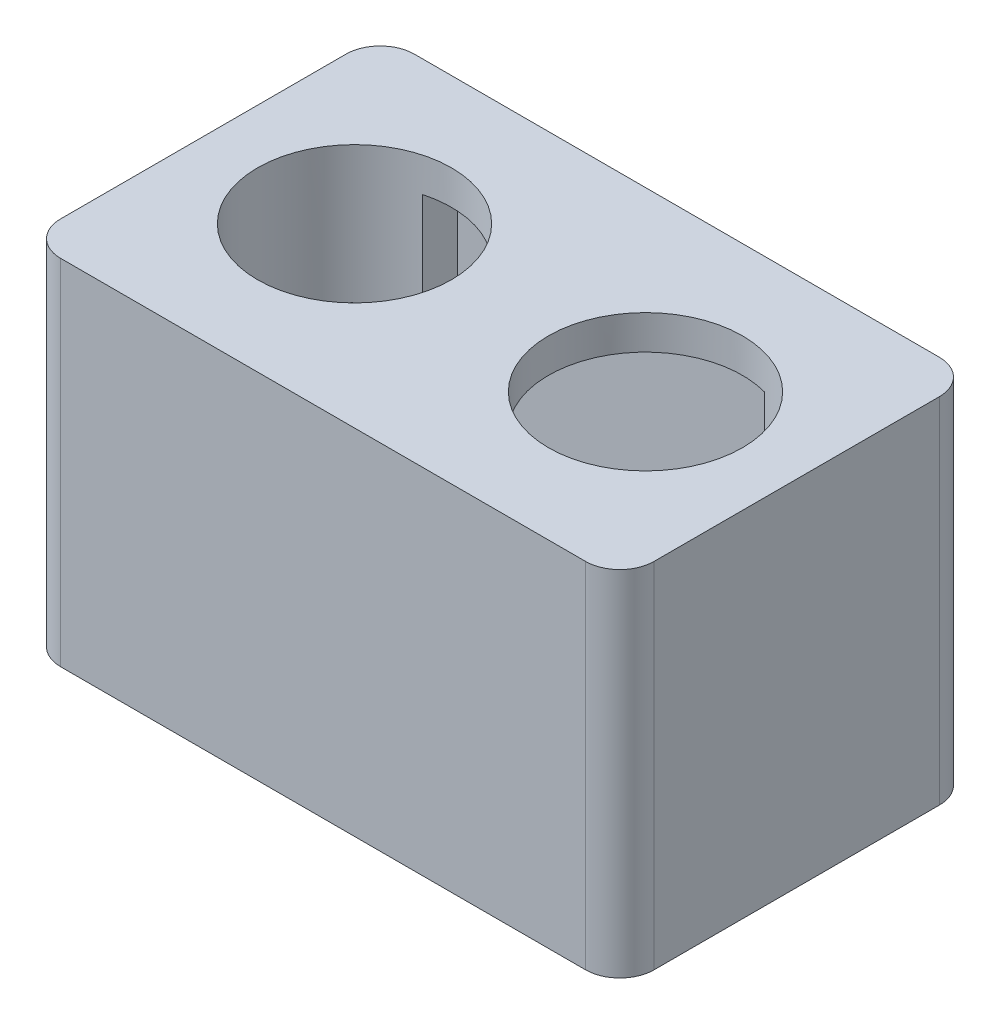
from build123d import *

# Parameters (mm, degrees)
CROQUIS1_W              = 52
CROQUIS1_H              = 31
CROQUIS1_W_2            = 46
CROQUIS1_H_2            = 25
SALIENTE_EXTRUIR1_DEPTH = 31
CROQUIS2_R              = 8.5
CORTAR_EXTRUIR1_DEPTH   = 31
REDONDEO1_R             = 3
VACIADO1_DEPTH          = 28
CROQUIS3_W              = 46
CROQUIS3_H              = 25
CORTAR_EXTRUIR2_DEPTH   = 19
CROQUIS4_W              = 30
CROQUIS4_H              = 23
CORTAR_EXTRUIR3_DEPTH   = 9


# Read off the part's stored shape, not the designer's step: Vaciado1
with BuildPart() as part:
    # Croquis1 → Saliente-Extruir1 (new body)
    # profile 1 of 2: a face of its own
    with BuildSketch(Plane(origin=(0, 0, 0), x_dir=(1, 0, 0), z_dir=(0, 1, 0))):
        Rectangle(CROQUIS1_W, CROQUIS1_H)
        Rectangle(CROQUIS1_W_2, CROQUIS1_H_2, mode=Mode.SUBTRACT)
    # profile 2 of 2: a face of its own
    with BuildSketch(Plane(origin=(0, 0, 0), x_dir=(1, 0, 0), z_dir=(0, 1, 0))):
        Rectangle(CROQUIS1_W_2, CROQUIS1_H_2)
    extrude(amount=SALIENTE_EXTRUIR1_DEPTH)

    # Croquis2 → Cortar-Extruir1 (cut)
    with BuildSketch(Plane(origin=(0, 31, 0), x_dir=(1, 0, 0), z_dir=(0, 1, 0))):
        with Locations(Location((-12.75, 0, 0), (0, 0, 270))):
            Circle(CROQUIS2_R)
        with Locations(Location((12.75, 0, 0), (0, 0, 270))):
            Circle(CROQUIS2_R)
    extrude(amount=-CORTAR_EXTRUIR1_DEPTH, mode=Mode.SUBTRACT)

    # Redondeo1
    redondeo1_edges = [part.edges().sort_by_distance(p)[0] for p in [
        (26, 15.5, 15.5),
        (-26, 15.5, 15.5),
        (-26, 15.5, -15.5),
        (26, 15.5, -15.5),
    ]]
    fillet(redondeo1_edges, radius=REDONDEO1_R)

    # Vaciado1 outline → Vaciado1 (cut)
    with BuildSketch(Plane(origin=(0, 0, 0), x_dir=(1, 0, 0), z_dir=(0, 1, 0))):
        with BuildLine():
            Line((-23, 12.5), (-23, 5.214163404))
            ThreePointArc((-23, 5.214163404), (-1.25, 0), (-23, -5.214163404))
            Line((-23, -5.214163404), (-23, -12.5))
            Line((-23, -12.5), (23, -12.5))
            Line((23, -12.5), (23, -5.214163404))
            ThreePointArc((23, -5.214163404), (1.25, 0), (23, 5.214163404))
            Line((23, 5.214163404), (23, 12.5))
            Line((23, 12.5), (-23, 12.5))
        make_face()
    extrude(amount=VACIADO1_DEPTH, mode=Mode.SUBTRACT)

    # Croquis3 → Cortar-Extruir2 (cut)
    with BuildSketch(Plane.XZ):
        Rectangle(CROQUIS3_W, CROQUIS3_H)
    extrude(amount=-CORTAR_EXTRUIR2_DEPTH, mode=Mode.SUBTRACT)

    # Croquis4 → Cortar-Extruir3 (cut)
    with BuildSketch(Plane.XZ.offset(-19)):
        Rectangle(CROQUIS4_W, CROQUIS4_H)
    extrude(amount=-CORTAR_EXTRUIR3_DEPTH, mode=Mode.SUBTRACT)


solid = part.part
